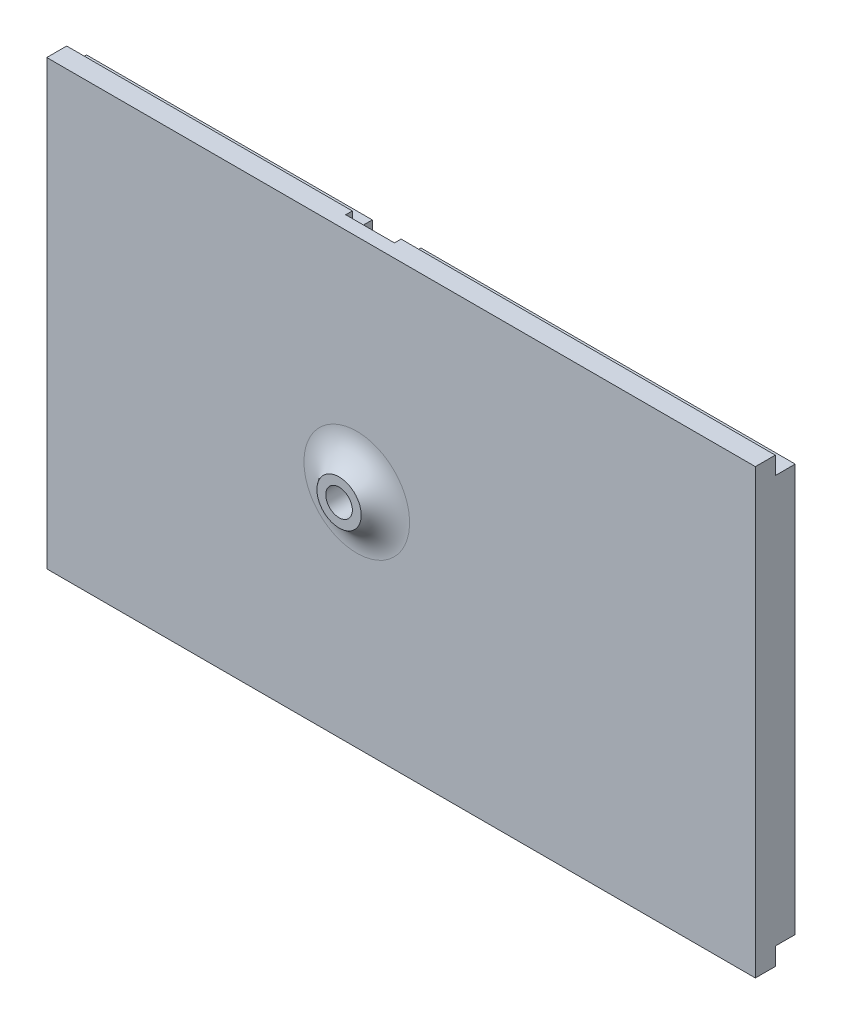
from build123d import *

# Parameters (mm, degrees)
SKETCH1_W           = 50
SKETCH1_H           = 80
BOSS_EXTRUDE1_DEPTH = 4.5
SKETCH2_R           = 0.5
CUT_EXTRUDE1_DEPTH  = 95.447075127
SKETCH3_W           = 2
SKETCH3_H           = 2.25
CUT_EXTRUDE2_DEPTH  = 95.447075127
SKETCH5_R           = 2.5
BOSS_EXTRUDE2_DEPTH = 2
SKETCH6_R           = 1.5
CUT_EXTRUDE3_DEPTH  = 95.563470748
FILLET1_R           = 4
SKETCH8_W           = 5.5
SKETCH8_H           = 30
CUT_EXTRUDE4_DEPTH  = 3


with BuildPart() as part:
    # Sketch1 → Boss-Extrude1 (new body)
    with BuildSketch(Plane(origin=(0, 0, 0), x_dir=(0, 1, 0), z_dir=(0, 0, 1))):
        with Locations((25, 40)):
            Rectangle(SKETCH1_W, SKETCH1_H)
    extrude(amount=BOSS_EXTRUDE1_DEPTH)

    # Sketch2 → Cut-Extrude1 (cut, through all)
    with BuildSketch(Plane.XY.offset(4.5)):
        with Locations((-45, 25)):
            Circle(SKETCH2_R)
    extrude(amount=-CUT_EXTRUDE1_DEPTH, mode=Mode.SUBTRACT)

    # Sketch3 → Cut-Extrude2 (cut, through all)
    with BuildSketch(Plane(origin=(-80, 0, 0), x_dir=(0, -1, 0), z_dir=(-1, 0, 0))):
        with Locations((-49, 1.125)):
            Rectangle(SKETCH3_W, SKETCH3_H)
        with Locations((-1, 1.125)):
            Rectangle(SKETCH3_W, SKETCH3_H)
    extrude(amount=-CUT_EXTRUDE2_DEPTH, mode=Mode.SUBTRACT)

    # Sketch5 → Boss-Extrude2 (add)
    with BuildSketch(Plane.XY.offset(4.5)):
        with Locations(Location((-45, 25, 0), (0, 0, 180))):
            Circle(SKETCH5_R)
    extrude(amount=BOSS_EXTRUDE2_DEPTH)

    # Sketch6 → Cut-Extrude3 (cut, through all)
    with BuildSketch(Plane.XY.offset(6.5)):
        with Locations((-45, 25)):
            Circle(SKETCH6_R)
    extrude(amount=-CUT_EXTRUDE3_DEPTH, mode=Mode.SUBTRACT)

    # Fillet1
    # the kernel refuses this fillet: 4 mm, written as the material it adds along each edge
    with BuildSketch(Plane(origin=(-45, 25, 4.5), x_dir=(-1, 0, 0), z_dir=(0, 1, 0))) as fillet1_piece_1:
        with BuildLine():
            CenterArc((5.964101615, 4), FILLET1_R, 210, 60)
            Line((2.5, 2), (2.430717968, 1.96))
            ThreePointArc((2.430717968, 1.96), (2.42, 1), (2.42, 0))
            Line((2.42, 0), (2.5, -0.08))
            Line((2.5, -0.08), (5.964101615, -0.08))
            Line((5.964101615, -0.08), (5.964101615, 0))
        make_face()
    revolve(axis=Axis((-45, 25, 4.5), (0, 0, 1)))

    # Sketch8 → Cut-Extrude4 (cut)
    with BuildSketch(Plane(origin=(0, 0, 0), x_dir=(1, 0, 0), z_dir=(0, 0, -1))):
        with Locations((-45, -35)):
            Rectangle(SKETCH8_W, SKETCH8_H)
    extrude(amount=-CUT_EXTRUDE4_DEPTH, mode=Mode.SUBTRACT)


solid = part.part
